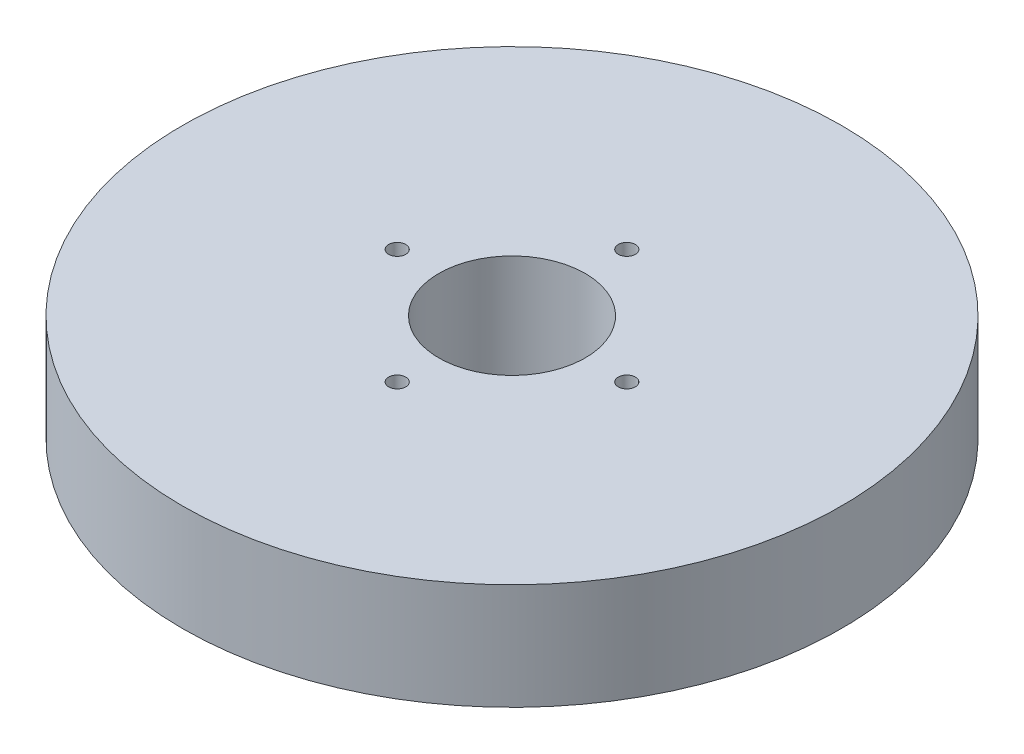
from build123d import *

# Parameters (mm, degrees)
SKETCH1_R           = 90
BOSS_EXTRUDE1_DEPTH = 29
SKETCH2_R           = 20
CUT_EXTRUDE1_DEPTH  = 131.541181242
SKETCH3_R           = 2.338703077
CUT_EXTRUDE2_DEPTH  = 19.330138655
CIRPATTERN1_COUNT   = 4


with BuildPart() as part:
    # Sketch1 → Boss-Extrude1 (new body)
    with BuildSketch(Plane(origin=(0, 0, 0), x_dir=(1, 0, 0), z_dir=(0, 1, 0))):
        Circle(SKETCH1_R)
    extrude(amount=BOSS_EXTRUDE1_DEPTH)

    # Sketch2 → Cut-Extrude1 (cut, through all)
    with BuildSketch(Plane(origin=(0, 0, 0), x_dir=(1, 0, 0), z_dir=(0, 1, 0))):
        Circle(SKETCH2_R)
    extrude(amount=CUT_EXTRUDE1_DEPTH, mode=Mode.SUBTRACT)

    # Sketch3 → Cut-Extrude2 (cut)
    with BuildSketch(Plane(origin=(0, 29, 0), x_dir=(1, 0, 0), z_dir=(0, 1, 0))):
        with Locations((-31.352392249, 0)):
            Circle(SKETCH3_R)
    cut_extrude2 = extrude(amount=-CUT_EXTRUDE2_DEPTH, mode=Mode.SUBTRACT)

    # CirPattern1: Cut-Extrude2 ×4 about axis
    cirpattern1_axis = Axis((0, 0, 0), (0, 1, 0))
    for i in range(1, CIRPATTERN1_COUNT):
        add(cut_extrude2.rotate(cirpattern1_axis, i * 360 / CIRPATTERN1_COUNT), mode=Mode.SUBTRACT)


solid = part.part
